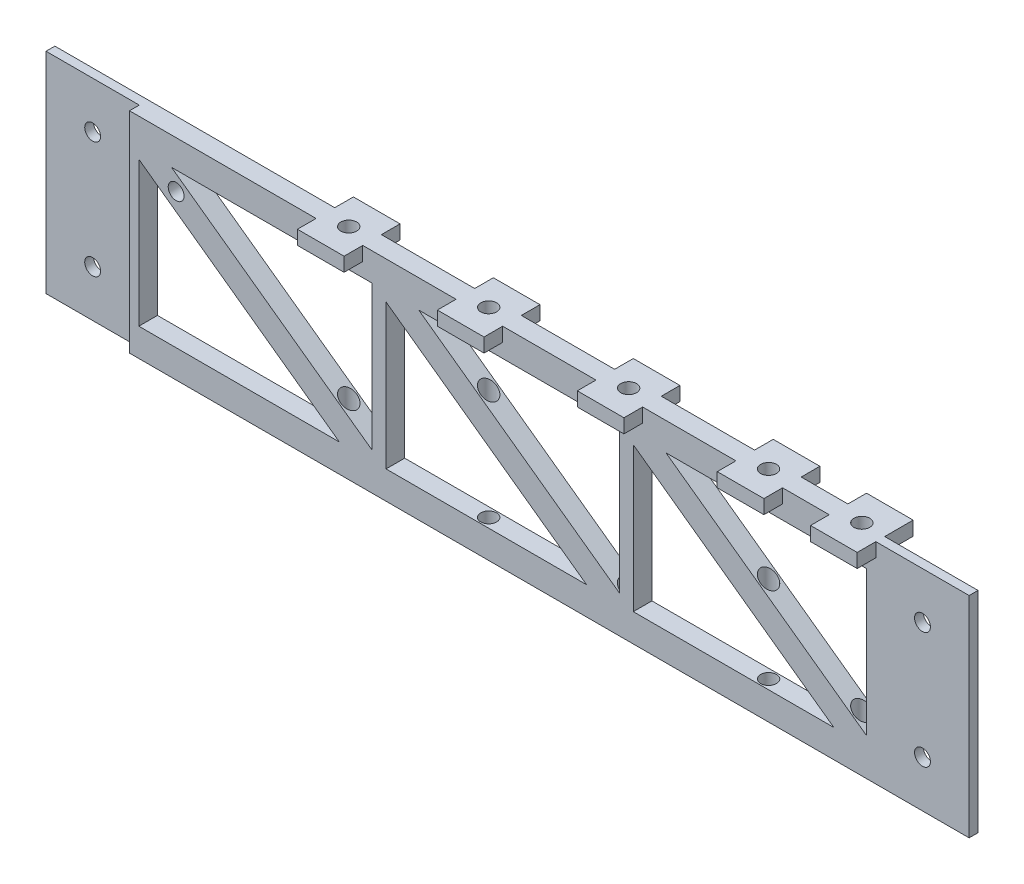
from build123d import *

# Parameters (mm, degrees)
SKETCH_1_W                   = 200
SKETCH_1_H                   = 45
EXTRUDE_45_4_DEPTH           = 4
CUT_EXTRUDE_658_DEPTH        = 206.039020677
CUT_EXTRUDE_658_DEPTH_BACK   = 206.039020677
CUT_EXTRUDE_835_DEPTH        = 206.039020677
CUT_EXTRUDE_835_DEPTH_BACK   = 206.039020677
SKETCH_3_W                   = 20
SKETCH_3_H                   = 2.1
CUT_EXTRUDE_3P4_DEPTH        = 206.039020677
CUT_EXTRUDE_3P4_DEPTH_BACK   = 206.039020677
SKETCH_4_R                   = 1.7
EXTRUDE_START                = -4
SKETCH_5_W                   = 10
SKETCH_5_H                   = 3
EXTRUDE_1463_DEPTH           = 12
CUT_EXTRUDE_3P4_2_DEPTH      = 206.156038176
CUT_EXTRUDE_3P4_2_DEPTH_BACK = 206.156038176
SKETCH_6_R                   = 1.7


with BuildPart() as part:
    # 草图1 → 45高4厚桁架毛坯 (new body)
    with BuildSketch(Plane.XY):
        with Locations((100, 22.5)):
            Rectangle(SKETCH_1_W, SKETCH_1_H)
    extrude(amount=EXTRUDE_45_4_DEPTH)

    # 草图2 → Cut-Extrude 658 (cut, two sides: drawn at the far end of the back side and taken through both)
    with BuildSketch(Plane.XY.offset(-CUT_EXTRUDE_658_DEPTH_BACK)):
        Polygon((22, 6), (65, 6), (22, 37), align=None)
        Polygon((29, 39), (72, 8), (72, 39), align=None)
        Polygon((75, 6), (118, 6), (75, 37), align=None)
        Polygon((82, 39), (125, 8), (125, 39), align=None)
        Polygon((128, 6), (171, 6), (128, 37), align=None)
        Polygon((135, 39), (178, 8), (178, 39), align=None)
    extrude(amount=CUT_EXTRUDE_658_DEPTH + CUT_EXTRUDE_658_DEPTH_BACK, mode=Mode.SUBTRACT)

    # 草图3 → Cut-Extrude 835 (cut, two sides: drawn at the far end of the back side and taken through both)
    with BuildSketch(Plane(origin=(0, 0, 0), x_dir=(1, 0, 0), z_dir=(0, 1, 0)).offset(-CUT_EXTRUDE_835_DEPTH_BACK)):
        with Locations((10, -2.95)):
            Rectangle(SKETCH_3_W, SKETCH_3_H)
        with Locations((190, -1.05)):
            Rectangle(SKETCH_3_W, SKETCH_3_H)
    extrude(amount=CUT_EXTRUDE_835_DEPTH + CUT_EXTRUDE_835_DEPTH_BACK, mode=Mode.SUBTRACT)

    # 草图4 → Cut-Extrude 3p4 (cut, two sides: drawn at the far end of the back side and taken through both)
    with BuildSketch(Plane.XY.offset(-CUT_EXTRUDE_3P4_DEPTH_BACK)):
        with Locations((10, 10)):
            Circle(SKETCH_4_R)
        with Locations((10, 35)):
            Circle(SKETCH_4_R)
        with Locations((30, 10)):
            Circle(SKETCH_4_R)
        with Locations((30, 35)):
            Circle(SKETCH_4_R)
        with Locations((190, 10)):
            Circle(SKETCH_4_R)
        with Locations((190, 35)):
            Circle(SKETCH_4_R)
    extrude(amount=CUT_EXTRUDE_3P4_DEPTH + CUT_EXTRUDE_3P4_DEPTH_BACK, mode=Mode.SUBTRACT)

    # 草图5 → Extrude 1463 (add)
    with BuildSketch(Plane.XY.offset(EXTRUDE_START)):
        with Locations((65, 43.5)):
            Rectangle(SKETCH_5_W, SKETCH_5_H)
        with Locations((95, 43.5)):
            Rectangle(SKETCH_5_W, SKETCH_5_H)
        with Locations((125, 43.5)):
            Rectangle(SKETCH_5_W, SKETCH_5_H)
        with Locations((155, 43.5)):
            Rectangle(SKETCH_5_W, SKETCH_5_H)
        with Locations((175, 43.5)):
            Rectangle(SKETCH_5_W, SKETCH_5_H)
    extrude(amount=EXTRUDE_1463_DEPTH)

    # 草图6 → Cut-Extrude 3p4 2 (cut, two sides: drawn at the far end of the back side and taken through both)
    with BuildSketch(Plane(origin=(0, 0, 0), x_dir=(1, 0, 0), z_dir=(0, 1, 0)).offset(-CUT_EXTRUDE_3P4_2_DEPTH_BACK)):
        with Locations((65, -2)):
            Circle(SKETCH_6_R)
        with Locations((95, -2)):
            Circle(SKETCH_6_R)
        with Locations((125, -2)):
            Circle(SKETCH_6_R)
        with Locations((155, -2)):
            Circle(SKETCH_6_R)
        with Locations((175, -2)):
            Circle(SKETCH_6_R)
    extrude(amount=CUT_EXTRUDE_3P4_2_DEPTH + CUT_EXTRUDE_3P4_2_DEPTH_BACK, mode=Mode.SUBTRACT)


solid = part.part
